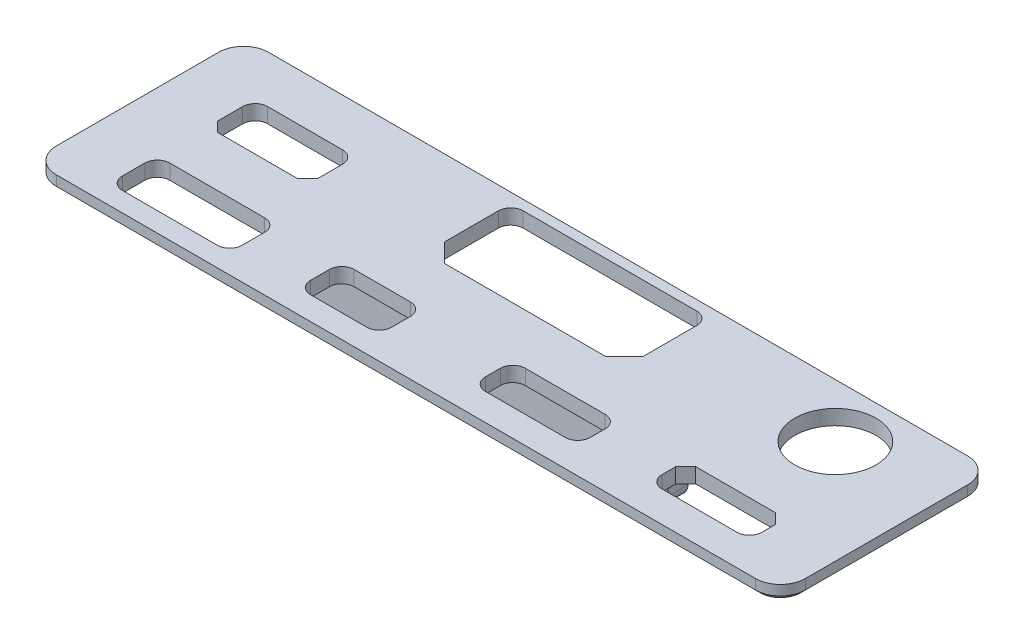
from build123d import *

# Parameters (mm, degrees)
SKETCH_1_W          = 60
SKETCH_1_H          = 17
EXTRUDE_1_DEPTH     = 1.2
CUT_EXTRUDE_1_REACH = 33.204
SKETCH_4_R          = 3.25
SKETCH_4_W          = 8
SKETCH_4_H          = 3.8
SKETCH_4_W_2        = 15.9
SKETCH_4_H_2        = 6.8
SKETCH_4_H_3        = 2.9
SKETCH_4_W_3        = 8.4
SKETCH_4_H_4        = 3.2
SKETCH_4_W_4        = 6.5
SKETCH_4_H_5        = 3.5
SKETCH_4_W_5        = 9.6
FILLET_2_R          = 1
CHAMFER_1_SIZE      = 0.8
SKETCH_5_W          = 1.5
SKETCH_5_H          = 8
EXTRUDE_2_DEPTH     = 1.2
SKETCH_6_W          = 28.5
SKETCH_6_H          = 1.6
EXTRUDE_3_DEPTH     = 4
FILLET_3_R          = 1
CHAMFER_2_SIZE      = 1
FILLET_4_R          = 2
CHAMFER_5_SIZE      = 0.4
CHAMFER_6_SIZE      = 1.5


with BuildPart() as part:
    # 草图1 → 凸台-拉伸1 (new body)
    with BuildSketch(Plane(origin=(0, 0, 0), x_dir=(1, 0, 0), z_dir=(0, 1, 0))):
        Rectangle(SKETCH_1_W, SKETCH_1_H)
    extrude(amount=EXTRUDE_1_DEPTH)

    # 草图4 → 切除-拉伸1 (cut, up to next)
    with BuildSketch(Plane(origin=(0, 1.2, 0), x_dir=(1, 0, 0), z_dir=(0, 1, 0)), mode=Mode.PRIVATE) as cut_extrude_1_sk1:
        with Locations((21.7, 4.2)):
            Circle(SKETCH_4_R)
    cut_extrude_1_tool1 = extrude(cut_extrude_1_sk1.sketch, amount=-CUT_EXTRUDE_1_REACH, mode=Mode.PRIVATE) & part.part
    # 草图4 → 切除-拉伸1 (cut, up to next)
    with BuildSketch(Plane(origin=(0, 1.2, 0), x_dir=(1, 0, 0), z_dir=(0, 1, 0)), mode=Mode.PRIVATE) as cut_extrude_1_sk2:
        with Locations((-21.271722325, 2.8)):
            Rectangle(SKETCH_4_W, SKETCH_4_H)
    cut_extrude_1_tool2 = extrude(cut_extrude_1_sk2.sketch, amount=-CUT_EXTRUDE_1_REACH, mode=Mode.PRIVATE) & part.part
    # 草图4 → 切除-拉伸1 (cut, up to next)
    with BuildSketch(Plane(origin=(0, 1.2, 0), x_dir=(1, 0, 0), z_dir=(0, 1, 0)), mode=Mode.PRIVATE) as cut_extrude_1_sk3:
        with Locations((0.15, 4.3)):
            Rectangle(SKETCH_4_W_2, SKETCH_4_H_2)
    cut_extrude_1_tool3 = extrude(cut_extrude_1_sk3.sketch, amount=-CUT_EXTRUDE_1_REACH, mode=Mode.PRIVATE) & part.part
    # 草图4 → 切除-拉伸1 (cut, up to next)
    with BuildSketch(Plane(origin=(0, 1.2, 0), x_dir=(1, 0, 0), z_dir=(0, 1, 0)), mode=Mode.PRIVATE) as cut_extrude_1_sk4:
        with Locations((21.05, -4.584803861)):
            Rectangle(SKETCH_4_W, SKETCH_4_H_3)
    cut_extrude_1_tool4 = extrude(cut_extrude_1_sk4.sketch, amount=-CUT_EXTRUDE_1_REACH, mode=Mode.PRIVATE) & part.part
    # 草图4 → 切除-拉伸1 (cut, up to next)
    with BuildSketch(Plane(origin=(0, 1.2, 0), x_dir=(1, 0, 0), z_dir=(0, 1, 0)), mode=Mode.PRIVATE) as cut_extrude_1_sk5:
        with Locations((7.4, -4.734803861)):
            Rectangle(SKETCH_4_W_3, SKETCH_4_H_4)
    cut_extrude_1_tool5 = extrude(cut_extrude_1_sk5.sketch, amount=-CUT_EXTRUDE_1_REACH, mode=Mode.PRIVATE) & part.part
    # 草图4 → 切除-拉伸1 (cut, up to next)
    with BuildSketch(Plane(origin=(0, 1.2, 0), x_dir=(1, 0, 0), z_dir=(0, 1, 0)), mode=Mode.PRIVATE) as cut_extrude_1_sk6:
        with Locations((-7.25, -4.884803861)):
            Rectangle(SKETCH_4_W_4, SKETCH_4_H_5)
    cut_extrude_1_tool6 = extrude(cut_extrude_1_sk6.sketch, amount=-CUT_EXTRUDE_1_REACH, mode=Mode.PRIVATE) & part.part
    # 草图4 → 切除-拉伸1 (cut, up to next)
    with BuildSketch(Plane(origin=(0, 1.2, 0), x_dir=(1, 0, 0), z_dir=(0, 1, 0)), mode=Mode.PRIVATE) as cut_extrude_1_sk7:
        with Locations((-20.471722325, -5.034803861)):
            Rectangle(SKETCH_4_W_5, SKETCH_4_H)
    cut_extrude_1_tool7 = extrude(cut_extrude_1_sk7.sketch, amount=-CUT_EXTRUDE_1_REACH, mode=Mode.PRIVATE) & part.part
    add(cut_extrude_1_tool1.solids().sort_by_distance((21.7, 1.2, -4.2))[0], mode=Mode.SUBTRACT)
    add(cut_extrude_1_tool2.solids().sort_by_distance((-21.271722, 1.2, -2.8))[0], mode=Mode.SUBTRACT)
    add(cut_extrude_1_tool3.solids().sort_by_distance((0.15, 1.2, -4.3))[0], mode=Mode.SUBTRACT)
    add(cut_extrude_1_tool4.solids().sort_by_distance((21.05, 1.2, 4.584804))[0], mode=Mode.SUBTRACT)
    add(cut_extrude_1_tool5.solids().sort_by_distance((7.4, 1.2, 4.734804))[0], mode=Mode.SUBTRACT)
    add(cut_extrude_1_tool6.solids().sort_by_distance((-7.25, 1.2, 4.884804))[0], mode=Mode.SUBTRACT)
    add(cut_extrude_1_tool7.solids().sort_by_distance((-20.471722, 1.2, 5.034804))[0], mode=Mode.SUBTRACT)

    # 圆角2
    fillet_2_edges = [part.edges().sort_by_distance(p)[0] for p in [
        (-25.271722325, 0.6, -4.7),
        (-17.271722325, 0.6, -4.7),
        (8.1, 0.6, -7.7),
        (-7.8, 0.6, -7.7),
        (25.05, 0.6, 6.034803861),
        (17.05, 0.6, 6.034803861),
        (11.6, 0.6, 6.334803861),
        (11.6, 0.6, 3.134803861),
        (3.2, 0.6, 3.134803861),
        (3.2, 0.6, 6.334803861),
        (-4, 0.6, 6.634803861),
        (-4, 0.6, 3.134803861),
        (-10.5, 0.6, 3.134803861),
        (-10.5, 0.6, 6.634803861),
        (-15.671722325, 0.6, 6.934803861),
        (-15.671722325, 0.6, 3.134803861),
        (-25.271722325, 0.6, 3.134803861),
        (-25.271722325, 0.6, 6.934803861),
    ]]
    fillet(fillet_2_edges, radius=FILLET_2_R)

    # 倒角1
    chamfer_1_edges = [part.edges().sort_by_distance(p)[0] for p in [
        (17.05, 0.6, 3.134803861),
        (25.05, 0.6, 3.134803861),
        (-17.271722325, 0.6, -0.9),
        (-25.271722325, 0.6, -0.9),
    ]]
    chamfer(chamfer_1_edges, length=CHAMFER_1_SIZE)

    # 草图5 → 凸台-拉伸2 (add)
    with BuildSketch(Plane.XZ):
        with Locations((-13.15891381, 0.61681071)):
            Rectangle(SKETCH_5_W, SKETCH_5_H)
        with Locations((13.84108619, 0.61681071)):
            Rectangle(SKETCH_5_W, SKETCH_5_H)
    extrude(amount=EXTRUDE_2_DEPTH)

    # 草图6 → 凸台-拉伸3 (add)
    with BuildSketch(Plane.XZ):
        with Locations((0.34108619, 1.3)):
            Rectangle(SKETCH_6_W, SKETCH_6_H)
    extrude(amount=EXTRUDE_3_DEPTH)

    # 圆角3
    fillet_3_edges = [part.edges().sort_by_distance(p)[0] for p in [
        (14.59108619, -4, 1.3),
        (-13.90891381, -4, 1.3),
    ]]
    fillet(fillet_3_edges, radius=FILLET_3_R)

    # 倒角2
    chamfer_2_edges = [part.edges().sort_by_distance(p)[0] for p in [
        (13.84108619, -1.2, -3.38318929),
        (-13.15891381, -1.2, -3.38318929),
        (13.84108619, -1.2, 4.61681071),
        (-13.15891381, -1.2, 4.61681071),
    ]]
    chamfer(chamfer_2_edges, length=CHAMFER_2_SIZE)

    # 圆角4
    fillet_4_edges = [part.edges().sort_by_distance(p)[0] for p in [
        (30, 0.6, 8.5),
        (30, 0.6, -8.5),
        (-30, 0.6, 8.5),
        (-30, 0.6, -8.5),
    ]]
    fillet(fillet_4_edges, radius=FILLET_4_R)

    # 倒角5
    chamfer_5_edges = [part.edges().sort_by_distance(p)[0] for p in [
        (0, 0, -8.5),
        (-29.414213562, 0, -7.914213562),
        (29.414213562, 0, -7.914213562),
        (-30, 0, 0),
        (30, 0, 0),
        (-29.414213562, 0, 7.914213562),
        (29.414213562, 0, 7.914213562),
        (0, 0, 8.5),
    ]]
    chamfer(chamfer_5_edges, length=CHAMFER_5_SIZE)

    # 倒角6
    chamfer_6_edges = [part.edges().sort_by_distance(p)[0] for p in [
        (8.1, 0.6, -0.9),
        (-7.8, 0.6, -0.9),
    ]]
    chamfer(chamfer_6_edges, length=CHAMFER_6_SIZE)


solid = part.part
